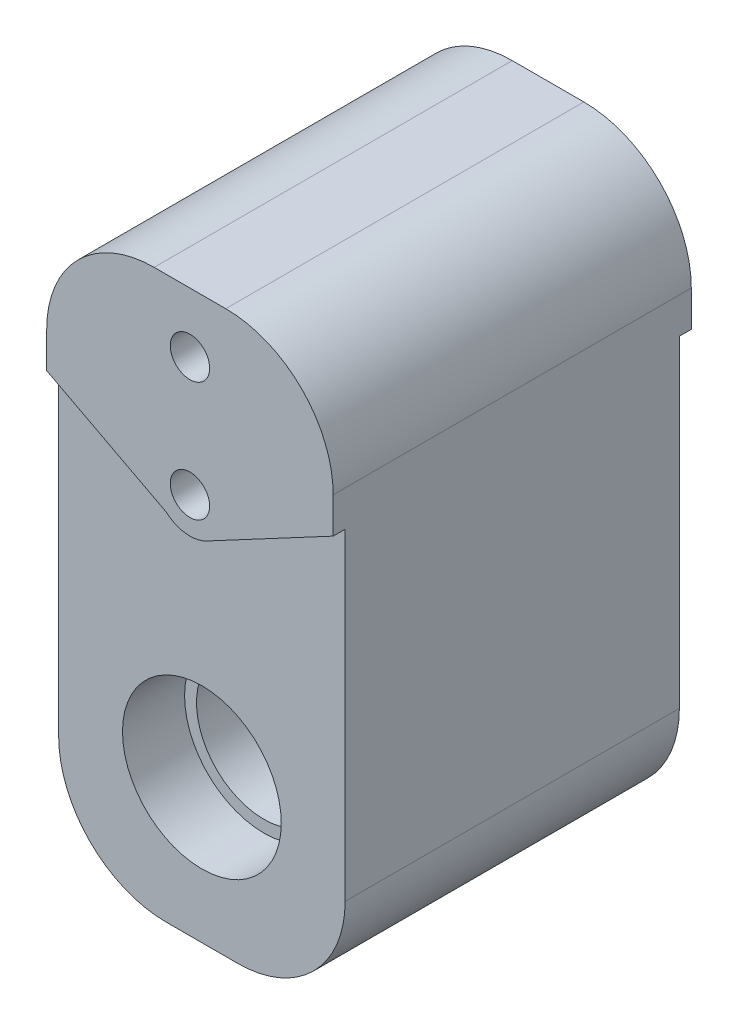
from build123d import *
from build123d.topology import SkipClean

# Parameters (mm, degrees)
EXTRUDE_452_DEPTH      = 14
EXTRUDE_452_DEPTH_BACK = 14
SKETCH_1_W             = 24
SKETCH_1_H             = 48
SKETCH_2_R             = 6.65
CUT_EXTRUDE_596_DEPTH  = 5.2
SKETCH_4_R             = 5.65
CUT_EXTRUDE_727_DEPTH  = 45.27008019
SKETCH_5_R             = 1.65
CUT_EXTRUDE_983_DEPTH  = 48.15930449
FILLET_1_R             = 9
SKETCH_9_R             = 1.65
EXTRUDE_1426_DEPTH     = 1
FILLET_2_R             = 9


with BuildPart() as part:
    # Эскиз1 → Extrude 452 (new, two sides: drawn at the far end of the back side and taken through both)
    with BuildSketch(Plane.XY.offset(-EXTRUDE_452_DEPTH_BACK)):
        with Locations((0, 12)):
            Rectangle(SKETCH_1_W, SKETCH_1_H)
    extrude(amount=EXTRUDE_452_DEPTH + EXTRUDE_452_DEPTH_BACK)

    # Эскиз2 → Cut-Extrude 596 (cut)
    with BuildSketch(Plane.XY.offset(14)):
        Circle(SKETCH_2_R)
    cut_extrude_596 = extrude(amount=-CUT_EXTRUDE_596_DEPTH, mode=Mode.SUBTRACT)

    # Эскиз4 → Cut-Extrude 727 (cut, through all)
    with BuildSketch(Plane.XY.offset(8.8)):
        Circle(SKETCH_4_R)
    extrude(amount=-CUT_EXTRUDE_727_DEPTH, mode=Mode.SUBTRACT)

    # Зеркальное отражение2: Cut-Extrude 596 across plane
    add(cut_extrude_596.mirror(Plane.XY), mode=Mode.SUBTRACT)

    # Эскиз5 → Cut-Extrude 983 (cut, through all)
    with BuildSketch(Plane(origin=(0, 0, -14), x_dir=(-1, 0, 0), z_dir=(0, 0, -1))):
        with Locations((0, 31)):
            Circle(SKETCH_5_R)
        with Locations((0, 21)):
            Circle(SKETCH_5_R)
    extrude(amount=-CUT_EXTRUDE_983_DEPTH, mode=Mode.SUBTRACT)

    # Скругление1
    fillet_1_edges = [part.edges().sort_by_distance(p)[0] for p in [
        (12, -12, 0),
        (-12, -12, 0),
    ]]
    fillet(fillet_1_edges, radius=FILLET_1_R)

    # Эскиз9 → Extrude 1426 (add)
    with SkipClean():  # the faces are left unmerged after this step: merging them gives an invalid solid
        with BuildSketch(Plane.XY.offset(14)):
            with BuildLine():
                Line((-12, 36), (-12, 24))
                Line((-12, 24), (-1.994778095, 18.759272361))
                ThreePointArc((-1.994778095, 18.759272361), (-0.355320153, 18.021116385), (1.411764706, 18.352941176))
                Line((1.411764706, 18.352941176), (12, 24))
                Line((12, 24), (12, 36))
                Line((12, 36), (-12, 36))
            make_face()
            with Locations((0, 21)):
                Circle(SKETCH_9_R, mode=Mode.SUBTRACT)
            with Locations((0, 31)):
                Circle(SKETCH_9_R, mode=Mode.SUBTRACT)
        extrude_1426 = extrude(amount=EXTRUDE_1426_DEPTH)

    # Зеркальное отражение1: Extrude 1426 across plane
    with SkipClean():  # the faces are left unmerged after this step: merging them gives an invalid solid
        add(extrude_1426.mirror(Plane.XY))

    # Скругление2
    fillet_2_edges = [part.edges().sort_by_distance(p)[0] for p in [
        (12, 36, 0),
        (-12, 36, 0),
    ]]
    fillet(fillet_2_edges, radius=FILLET_2_R)


solid = part.part
